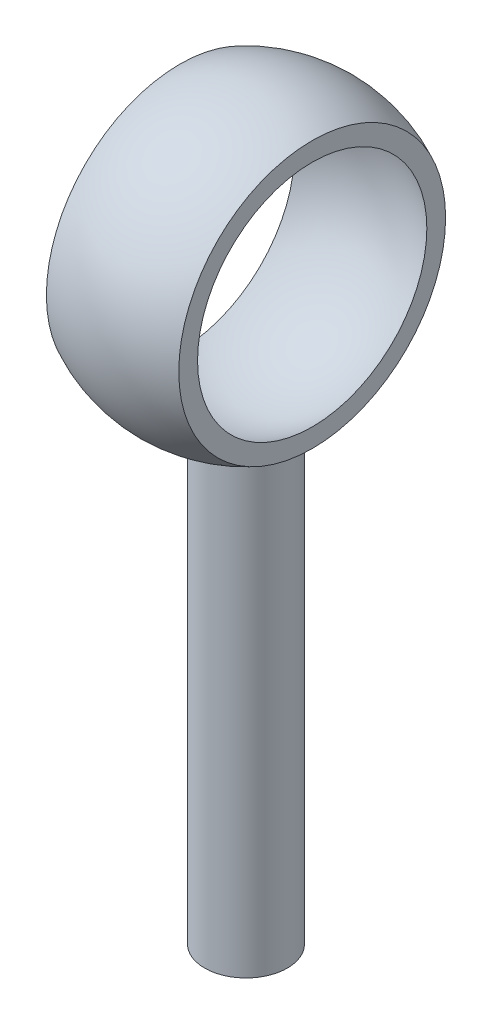
from build123d import *

# Parameters (mm, degrees)
CUT_EXTRUDE_START        = -8.062257748
CUT_EXTRUDE_1_OUTLINE_W  = 6
CUT_EXTRUDE_1_OUTLINE_H  = 20
CUT_EXTRUDE_1_DEPTH      = 16.124515496
BOSS_EXTRUDE1_DEPTH      = 1
BOSS_EXTRUDE1_DEPTH_BACK = 27
SKETCH3_R                = 2.5


# Read off the part's stored shape, not the designer's step: 切除-拉伸1
with BuildPart() as part:
    # 草图1 → 旋转1 (revolve)
    with BuildSketch(Plane(origin=(0, 0, 0), x_dir=(0, 0, -1), z_dir=(1, 0, 0))):
        with BuildLine():
            Line((0, 9), (0, -9))
            ThreePointArc((0, -9), (-9, 0), (0, 9))
        make_face()
    revolve(axis=Axis((0, 9, 0), (0, -1, 0)))

    # 切除-拉伸1 outline → 切除-拉伸1 (cut)
    with BuildSketch(Plane.XY.offset(CUT_EXTRUDE_START)):
        with Locations((-7, 0)):
            Rectangle(CUT_EXTRUDE_1_OUTLINE_W, CUT_EXTRUDE_1_OUTLINE_H)
        with Locations((7, 0)):
            Rectangle(CUT_EXTRUDE_1_OUTLINE_W, CUT_EXTRUDE_1_OUTLINE_H)
    extrude(amount=CUT_EXTRUDE_1_DEPTH, mode=Mode.SUBTRACT)

    # Sketch2 → Cut-Revolve1 (revolve, cut)
    with BuildSketch(Plane(origin=(0, 0, 0), x_dir=(1, 0, 0), z_dir=(0, 1, 0))):
        with BuildLine():
            Line((0, 8), (0, -8))
            ThreePointArc((0, -8), (8, 0), (0, 8))
        make_face()
    revolve(axis=Axis((0, 0, -8), (0, 0, 1)), mode=Mode.SUBTRACT)


with BuildPart() as body_2:
    # Sketch3 → Boss-Extrude1 (new, two sides: drawn at the far end of the back side and taken through both)
    with BuildSketch(Plane(origin=(0, -9, 0), x_dir=(1, 0, 0), z_dir=(0, 1, 0)).offset(-BOSS_EXTRUDE1_DEPTH_BACK)):
        with Locations(Location((0, 0, 0), (0, 0, 270))):
            Circle(SKETCH3_R)
    extrude(amount=BOSS_EXTRUDE1_DEPTH + BOSS_EXTRUDE1_DEPTH_BACK)


solid = Compound([part.part, body_2.part])
